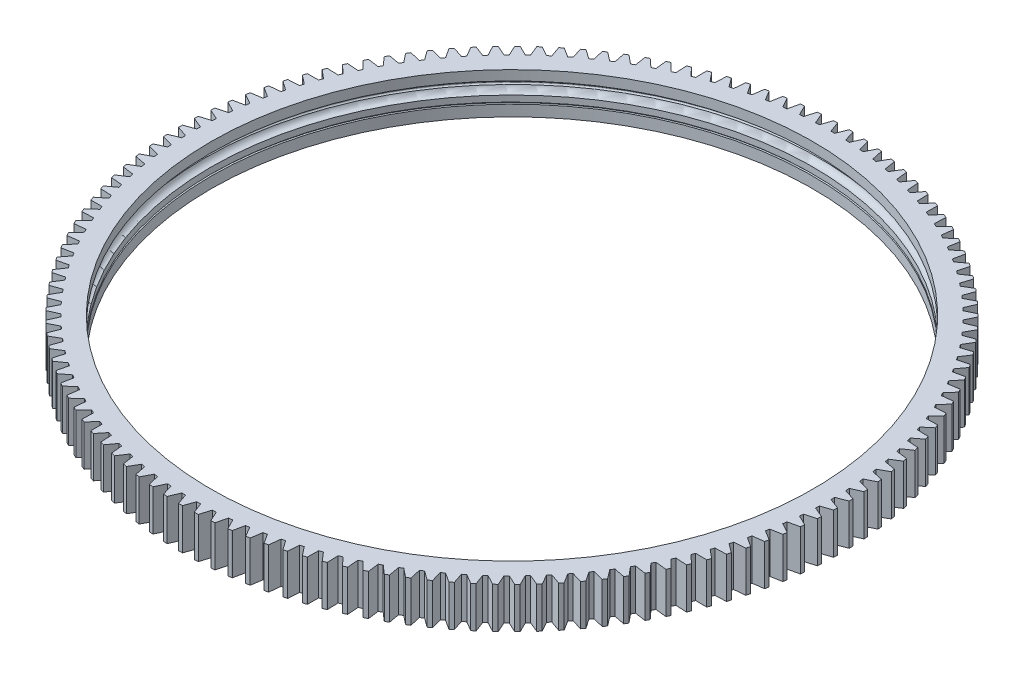
from build123d import *

# Parameters (mm, degrees)
ESQUISSE2_R                  = 8
ENL_V_MAT_EXTRU_4_DEPTH      = 1
R_P_TITION_CIRCULAIRE1_COUNT = 30
ENL_V_MAT_EXTRU_5_DEPTH      = 766.481730677
R_P_TITION_CIRCULAIRE5_COUNT = 133


with BuildPart() as part:
    # Esquisse1 → Révolution1 (revolve)
    with BuildSketch(Plane.XY):
        with BuildLine():
            ThreePointArc((-502.302631579, 21.976970948), (-498.833651811, 27.738530528), (-492.5, 30))
            Line((-492.5, 30), (-492.5, 46))
            Line((-492.5, 46), (-539.2, 46))
            Line((-539.2, 46), (-539.2, -21))
            Line((-539.2, -21), (-492.5, -21))
            Line((-492.5, -21), (-492.5, -3))
            Line((-492.5, -3), (-495.5, -3))
            Line((-495.5, -3), (-495.5, 0))
            Line((-495.5, 0), (-492.5, 0))
            Line((-492.5, 0), (-492.5, 10))
            ThreePointArc((-492.5, 10), (-498.833651811, 12.261469472), (-502.302631579, 18.023029052))
            ThreePointArc((-502.302631579, 18.023029052), (-504, 20), (-502.302631579, 21.976970948))
        make_face()
    revolve(axis=Axis((0, 58, 0), (0, -1, 0)))

    # Esquisse2 → Enlèv. mat.-Extru.4 (cut)
    with BuildSketch(Plane(origin=(0, -21, 0), x_dir=(-1, 0, 0), z_dir=(0, -1, 0))):
        with Locations((507.5, 0)):
            Circle(ESQUISSE2_R)
    extrude(amount=-ENL_V_MAT_EXTRU_4_DEPTH, mode=Mode.SUBTRACT)

    # Esquisse3 → Dégagement M161 (revolve, cut)
    with BuildSketch(Plane(origin=(-507.5, -21, 0), x_dir=(0, 0, -1), z_dir=(1, 0, 0))):
        Polygon((0, 0), (0, 23.208175881), (9.5, 17.5), (9.5, 0), align=None)
    d_gagement_m161 = revolve(axis=Axis((-507.5, -27.35, 0), (0, 1, 0)), mode=Mode.SUBTRACT)

    # Répétition circulaire1: Dégagement M161 ×30 about axis
    r_p_tition_circulaire1_axis = Axis((0, 45.15, 0), (0, -1, 0))
    for i in range(1, R_P_TITION_CIRCULAIRE1_COUNT):
        add(d_gagement_m161.rotate(r_p_tition_circulaire1_axis, i * 360 / R_P_TITION_CIRCULAIRE1_COUNT), mode=Mode.SUBTRACT)

    # Esquisse5 → Enlèv. mat.-Extru.5 (cut, through all)
    with BuildSketch(Plane(origin=(0, 46, 0), x_dir=(1, 0, 0), z_dir=(0, 1, 0))):
        Polygon((0, -539.2), (6.164936956, -521.963594087), (12.329013988, -521.854381427), (19.100665519, -538.86158202), (25.406998902, -538.601080956), (25.406998902, -556.229873137), (0, -556.831822232), align=None)
    enl_v_mat_extru_5 = extrude(amount=-ENL_V_MAT_EXTRU_5_DEPTH, mode=Mode.SUBTRACT)

    # Répétition circulaire5: Enlèv. mat.-Extru.5 ×133 about axis
    r_p_tition_circulaire5_axis = Axis((0, 45.15, 0), (0, -1, 0))
    for i in range(1, R_P_TITION_CIRCULAIRE5_COUNT):
        add(enl_v_mat_extru_5.rotate(r_p_tition_circulaire5_axis, i * 360 / R_P_TITION_CIRCULAIRE5_COUNT), mode=Mode.SUBTRACT)


solid = part.part
